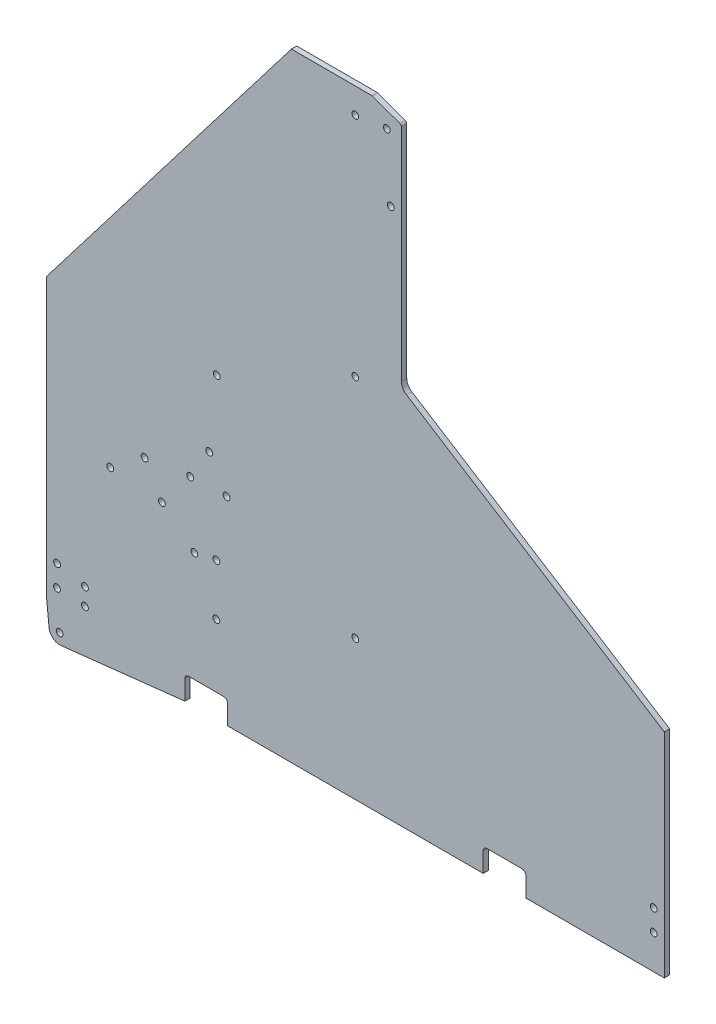
from build123d import *

# Parameters (mm, degrees)
SKETCH1_R           = 2.032
SKETCH1_R_2         = 2
BOSS_EXTRUDE1_DEPTH = 3.175
FILLET1_R           = 2.286
FILLET2_R           = 6.35
SKETCH2_R           = 2.032
CUT_EXTRUDE1_DEPTH  = 507.700158896
FILLET3_R           = 1.5875


with BuildPart() as part:
    # Sketch1 → Boss-Extrude1 (new body)
    with BuildSketch(Plane.XY):
        with BuildLine():
            Line((8.639060666, -28.536126099), (82.55, -20.32))
            Line((82.55, -20.32), (82.55, -6.35))
            Line((82.55, -6.35), (107.95, -6.35))
            Line((107.95, -6.35), (107.95, -20.32))
            Line((107.95, -20.32), (260.35, -20.32))
            Line((260.35, -20.32), (260.35, -6.35))
            Line((260.35, -6.35), (285.75, -6.35))
            Line((285.75, -6.35), (285.75, -20.32))
            Line((285.75, -20.32), (368.3, -20.32))
            Line((368.3, -20.32), (368.3, 106.68))
            Line((368.3, 106.68), (211.61375, 205.74))
            Line((211.61375, 205.74), (211.61375, 341.63))
            Line((211.61375, 341.63), (194.14998, 347.98))
            Line((194.14998, 347.98), (184.15, 347.98))
            Line((184.15, 347.98), (146.05, 347.98))
            Line((146.05, 347.98), (0, 157.48))
            Line((0, 157.48), (0, 0))
            Line((0, 0), (0, -6.35))
            ThreePointArc((0, -6.35), (0.007883354, -6.666317007), (0.031513842, -6.981848616))
            Line((0.031513842, -6.981848616), (1.619013842, -22.856848616))
            ThreePointArc((1.619013842, -22.856848616), (3.943628298, -27.161748811), (8.639060666, -28.536126099))
        make_face()
        with Locations((7.9375, -22.225)):
            Circle(SKETCH1_R, mode=Mode.SUBTRACT)
        with Locations((6.35, 0)):
            Circle(SKETCH1_R, mode=Mode.SUBTRACT)
        with Locations((6.35, 12.7)):
            Circle(SKETCH1_R, mode=Mode.SUBTRACT)
        with Locations((88.216909404, 59.136578314)):
            Circle(SKETCH1_R, mode=Mode.SUBTRACT)
        with Locations((184.15, 62.98)):
            Circle(SKETCH1_R_2, mode=Mode.SUBTRACT)
        with Locations((38.1, 78.105)):
            Circle(SKETCH1_R, mode=Mode.SUBTRACT)
        with Locations((68.887329744, 75.518700365)):
            Circle(SKETCH1_R, mode=Mode.SUBTRACT)
        with Locations((58.568579744, 93.391299635)):
            Circle(SKETCH1_R, mode=Mode.SUBTRACT)
        with Locations((85.725, 97.155)):
            Circle(SKETCH1_R, mode=Mode.SUBTRACT)
        with Locations((107.382158942, 97.743700365)):
            Circle(SKETCH1_R, mode=Mode.SUBTRACT)
        with Locations((97.063408942, 115.616299635)):
            Circle(SKETCH1_R, mode=Mode.SUBTRACT)
        with Locations((101.6, 157.48)):
            Circle(SKETCH1_R, mode=Mode.SUBTRACT)
        with Locations((361.95, 0)):
            Circle(SKETCH1_R, mode=Mode.SUBTRACT)
        with Locations((361.95, 12.7)):
            Circle(SKETCH1_R, mode=Mode.SUBTRACT)
        with Locations((184.15, 197.98)):
            Circle(SKETCH1_R_2, mode=Mode.SUBTRACT)
        with Locations((184.15, 332.98)):
            Circle(SKETCH1_R_2, mode=Mode.SUBTRACT)
        with Locations((205.26375, 296.418)):
            Circle(SKETCH1_R, mode=Mode.SUBTRACT)
        with Locations((202.881865, 335.28)):
            Circle(SKETCH1_R_2, mode=Mode.SUBTRACT)
    extrude(amount=BOSS_EXTRUDE1_DEPTH)

    # Fillet1
    fillet1_edges = [part.edges().sort_by_distance(p)[0] for p in [
        (285.75, -6.35, 1.5875),
        (107.95, -6.35, 1.5875),
        (260.35, -6.35, 1.5875),
        (82.55, -6.35, 1.5875),
    ]]
    fillet(fillet1_edges, radius=FILLET1_R)

    # Fillet2
    fillet2_edges = [part.edges().sort_by_distance(p)[0] for p in [
        (211.61375, 205.74, 1.5875),
    ]]
    fillet(fillet2_edges, radius=FILLET2_R)

    # Sketch2 → Cut-Extrude1 (cut, through all)
    with BuildSketch(Plane(origin=(0, 0, 0), x_dir=(-1, 0, 0), z_dir=(0, 0, -1))):
        with Locations((-101.339768613, 61.847479268)):
            Circle(SKETCH2_R)
        with Locations((-101.339768613, 31.367479268)):
            Circle(SKETCH2_R)
        with Locations((-23.011998341, 8.96398506)):
            Circle(SKETCH2_R)
        with Locations((-23.011998341, -1.19601494)):
            Circle(SKETCH2_R)
    extrude(amount=-CUT_EXTRUDE1_DEPTH, mode=Mode.SUBTRACT)

    # Fillet3
    fillet3_edges = [part.edges().sort_by_distance(p)[0] for p in [
        (211.61375, 341.63, 1.5875),
        (194.14998, 347.98, 1.5875),
    ]]
    fillet(fillet3_edges, radius=FILLET3_R)


solid = part.part
